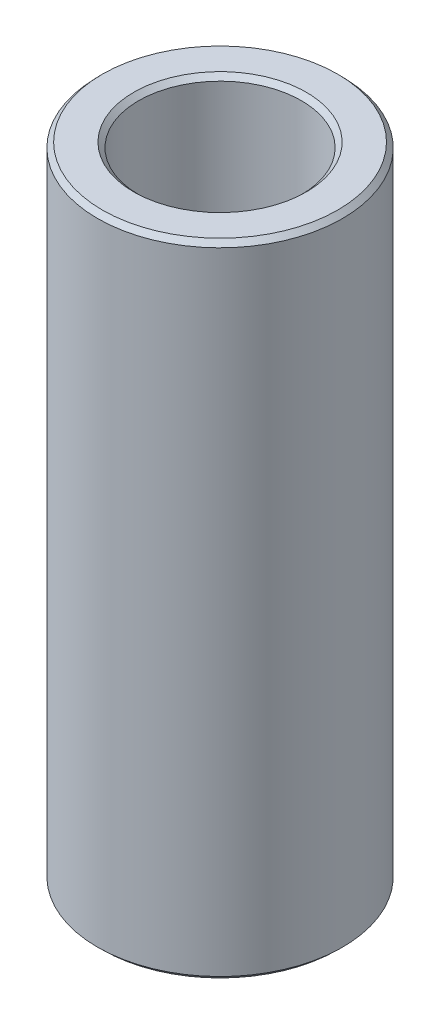
from build123d import *
from OCP.BRepFilletAPI import BRepFilletAPI_MakeChamfer

# Parameters (mm, degrees)
SKETCH1_R           = 15
BOSS_EXTRUDE1_DEPTH = 78.485496076
SKETCH2_R           = 9.969638788
CUT_EXTRUDE1_DEPTH  = 82.301741029
CHAMFER1_SIZE       = 0.607127327
CHAMFER1_SIZE2      = 0.583933786


with BuildPart() as part:
    # Sketch1 → Boss-Extrude1 (new body)
    with BuildSketch(Plane(origin=(0, 0, 0), x_dir=(1, 0, 0), z_dir=(0, 1, 0))):
        Circle(SKETCH1_R)
    extrude(amount=BOSS_EXTRUDE1_DEPTH)

    # Sketch2 → Cut-Extrude1 (cut, through all)
    with BuildSketch(Plane(origin=(0, 0, 0), x_dir=(1, 0, 0), z_dir=(0, 1, 0))):
        Circle(SKETCH2_R)
    extrude(amount=CUT_EXTRUDE1_DEPTH, mode=Mode.SUBTRACT)

    # Chamfer1: one chamfer whose edges measure the first distance from different faces: ONE call of the kernel's chamfer builder (chamfer() names one face for all edges)
    chamfer1_edges_1 = [part.edges().sort_by_distance(p)[0] for p in [
        (-9.969638788, 78.485496076, 0),
    ]]
    chamfer1_side_1 = [part.faces().sort_by_distance(p)[0] for p in [
        (-14.575735931, 78.485496076, 0),
    ]]
    chamfer1_edges_2 = [part.edges().sort_by_distance(p)[0] for p in [
        (-9.969638788, 0, 0),
    ]]
    chamfer1_side_2 = [part.faces().sort_by_distance(p)[0] for p in [
        (-9.969638788, 39.242748038, 0),
    ]]
    chamfer1_edges_3 = [part.edges().sort_by_distance(p)[0] for p in [
        (-15, 0, 0),
    ]]
    chamfer1_side_3 = [part.faces().sort_by_distance(p)[0] for p in [
        (-14.575735931, 0, 0),
    ]]
    chamfer1_edges_4 = [part.edges().sort_by_distance(p)[0] for p in [
        (-15, 78.485496076, 0),
    ]]
    chamfer1_side_4 = [part.faces().sort_by_distance(p)[0] for p in [
        (-15, 39.242748038, 0),
    ]]
    chamfer1 = BRepFilletAPI_MakeChamfer(part.part.solid().wrapped)
    for e in chamfer1_edges_1:
        chamfer1.Add(CHAMFER1_SIZE, CHAMFER1_SIZE2, e.wrapped, chamfer1_side_1[0].wrapped)  # the first distance lies on this face
    for e in chamfer1_edges_2:
        chamfer1.Add(CHAMFER1_SIZE, CHAMFER1_SIZE2, e.wrapped, chamfer1_side_2[0].wrapped)  # the first distance lies on this face
    for e in chamfer1_edges_3:
        chamfer1.Add(CHAMFER1_SIZE, CHAMFER1_SIZE2, e.wrapped, chamfer1_side_3[0].wrapped)  # the first distance lies on this face
    for e in chamfer1_edges_4:
        chamfer1.Add(CHAMFER1_SIZE, CHAMFER1_SIZE2, e.wrapped, chamfer1_side_4[0].wrapped)  # the first distance lies on this face
    add(Compound.cast(chamfer1.Shape()), mode=Mode.REPLACE)


solid = part.part
